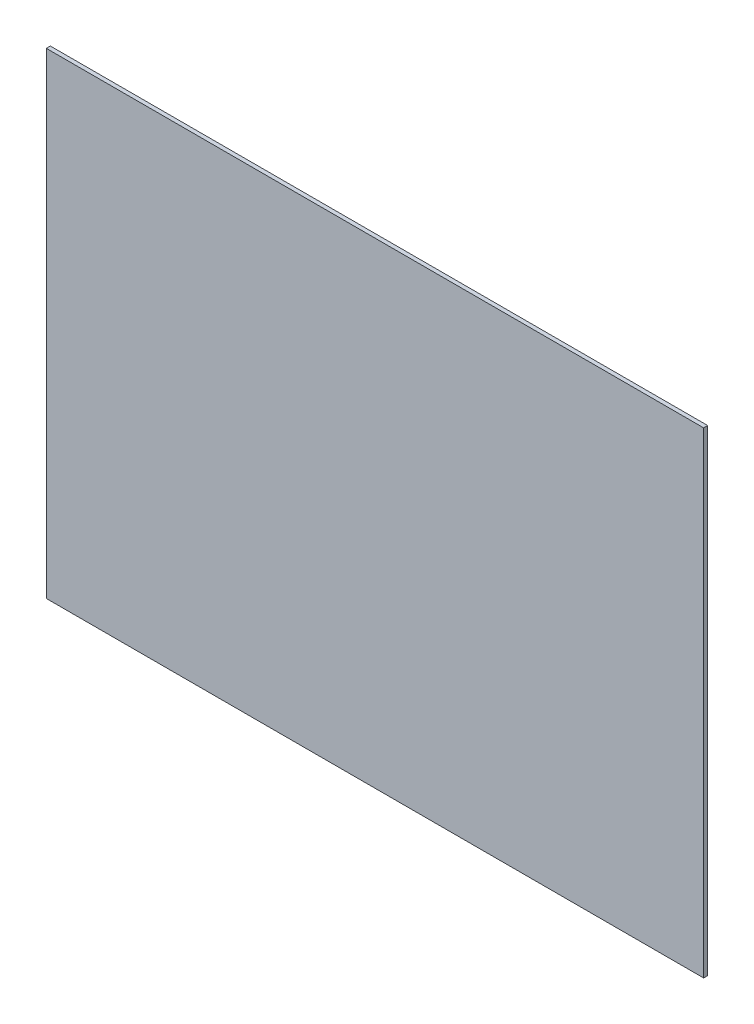
from build123d import *

# Parameters (mm, degrees)
SKETCH1_W           = 909.2
SKETCH1_H           = 659
BOSS_EXTRUDE1_DEPTH = 2.794


with BuildPart() as part:
    # Sketch1 → Boss-Extrude1 (new, symmetric)
    with BuildSketch(Plane.XY):
        Rectangle(SKETCH1_W, SKETCH1_H)
    extrude(amount=BOSS_EXTRUDE1_DEPTH, both=True)


solid = part.part
